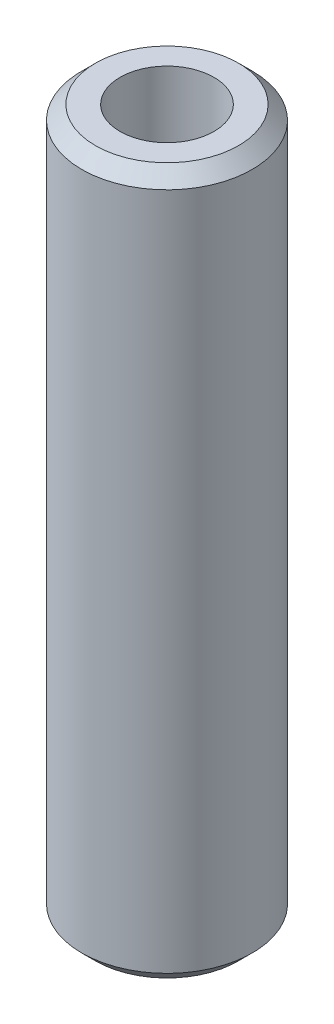
from build123d import *

# Parameters (mm, degrees)
SKETCH1_R           = 22.5
BOSS_EXTRUDE1_DEPTH = 186.339290713
SKETCH2_R           = 12.392998013
CUT_EXTRUDE1_DEPTH  = 190.036587103
CHAMFER1_SIZE       = 3.625145577


with BuildPart() as part:
    # Sketch1 → Boss-Extrude1 (new body)
    with BuildSketch(Plane(origin=(0, 0, 0), x_dir=(1, 0, 0), z_dir=(0, 1, 0))):
        Circle(SKETCH1_R)
    extrude(amount=BOSS_EXTRUDE1_DEPTH)

    # Sketch2 → Cut-Extrude1 (cut, through all)
    with BuildSketch(Plane(origin=(0, 0, 0), x_dir=(1, 0, 0), z_dir=(0, 1, 0))):
        Circle(SKETCH2_R)
    extrude(amount=CUT_EXTRUDE1_DEPTH, mode=Mode.SUBTRACT)

    # Chamfer1
    chamfer1_edges = [part.edges().sort_by_distance(p)[0] for p in [
        (-22.5, 186.339290713, 0),
        (-22.5, 0, 0),
    ]]
    chamfer(chamfer1_edges, length=CHAMFER1_SIZE)


solid = part.part
